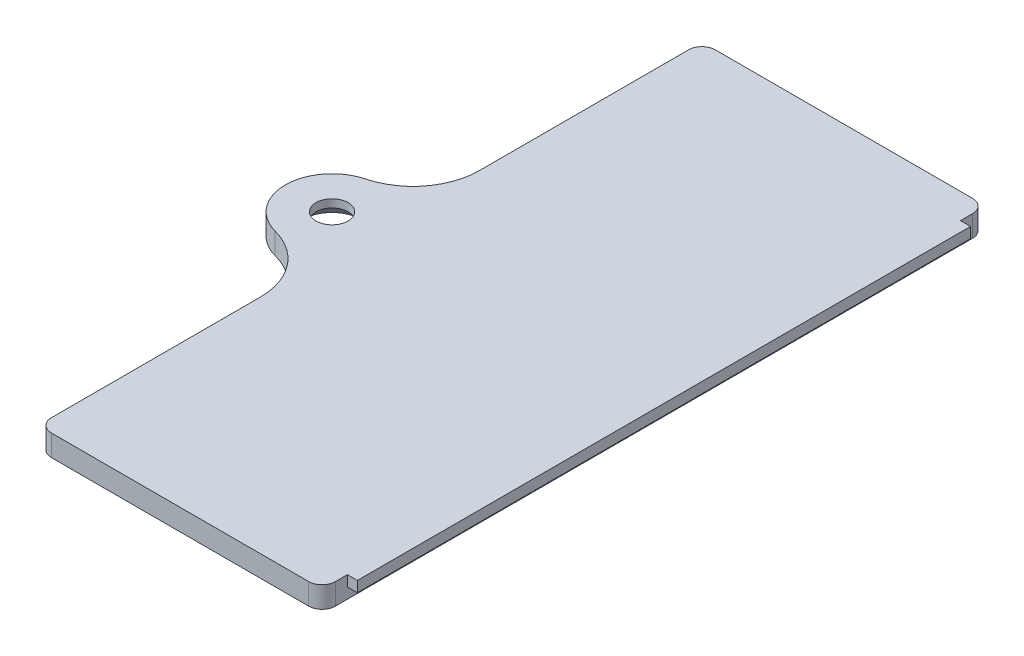
from build123d import *

# Parameters (mm, degrees)
DOOR_PLATE_1_6_SCREW_EAR_R5_R3_5_DEPTH        = 1.6
HOOK_FLANGE_0_75_X_0_8_INNER_FACE_P_2_W       = 0.9
HOOK_FLANGE_0_75_X_0_8_INNER_FACE_P_2_H       = 46
HOOK_FLANGE_0_75_X_0_8_INNER_FACE_PLANE_DEPTH = 0.8
SCREW_HOLE_2_4_FREE_SKETCH_R                  = 1.2
SCREW_HOLE_2_4_FREE_DEPTH                     = 73.114700304
SCREW_CSK_90DEG_M2_SIZE                       = 1
DOOR_CORNERS_R1_PRINT_R                       = 1


with BuildPart() as part:
    # Door Plate 1.6 + screw ear (R5 / R3.5) Sketch → Door Plate 1.6 + screw ear (R5 / R3.5) (new body)
    with BuildSketch(Plane(origin=(0, 0, 0), x_dir=(1, 0, 0), z_dir=(0, 1, 0))):
        with BuildLine():
            Line((9.35, 15.1), (30.65, 15.1))
            Line((30.65, 15.1), (30.65, 64.9))
            Line((30.65, 64.9), (9.35, 64.9))
            Line((9.35, 64.9), (9.35, 48.223594105))
            ThreePointArc((9.35, 48.223594105), (8.307494751, 45.167741475), (5.614705882, 43.386185808))
            ThreePointArc((5.614705882, 43.386185808), (3, 40), (5.614705882, 36.613814192))
            ThreePointArc((5.614705882, 36.613814192), (8.307494751, 34.832258525), (9.35, 31.776405895))
            Line((9.35, 31.776405895), (9.35, 15.1))
        make_face()
    extrude(amount=DOOR_PLATE_1_6_SCREW_EAR_R5_R3_5_DEPTH)

    # Hook Flange 0.75 x 0.8 _inner-face p 2 → Hook Flange 0.75 x 0.8 _inner-face plane (add)
    with BuildSketch(Plane(origin=(0, 0.8, 0), x_dir=(1, 0, 0), z_dir=(0, 1, 0))):
        with Locations((30.95, 40)):
            Rectangle(HOOK_FLANGE_0_75_X_0_8_INNER_FACE_P_2_W, HOOK_FLANGE_0_75_X_0_8_INNER_FACE_P_2_H)
    extrude(amount=HOOK_FLANGE_0_75_X_0_8_INNER_FACE_PLANE_DEPTH)

    # Screw Hole 2.4 (free) Sketch → Screw Hole 2.4 (free) (cut, through all)
    with BuildSketch(Plane(origin=(0, 0, 0), x_dir=(1, 0, 0), z_dir=(0, 1, 0))):
        with Locations((6.5, 40)):
            Circle(SCREW_HOLE_2_4_FREE_SKETCH_R)
    extrude(amount=SCREW_HOLE_2_4_FREE_DEPTH, mode=Mode.SUBTRACT)

    # Screw CSK 90deg (M2)
    screw_csk_90deg_m2_edges = [part.edges().sort_by_distance(p)[0] for p in [
        (5.3, 0, -40),
    ]]
    chamfer(screw_csk_90deg_m2_edges, length=SCREW_CSK_90DEG_M2_SIZE)

    # Door Corners R1 (print)
    door_corners_r1_print_edges = [part.edges().sort_by_distance(p)[0] for p in [
        (9.35, 0.8, -64.9),
        (30.65, 0.8, -64.9),
        (30.65, 0.8, -15.1),
        (9.35, 0.8, -15.1),
    ]]
    fillet(door_corners_r1_print_edges, radius=DOOR_CORNERS_R1_PRINT_R)


solid = part.part
